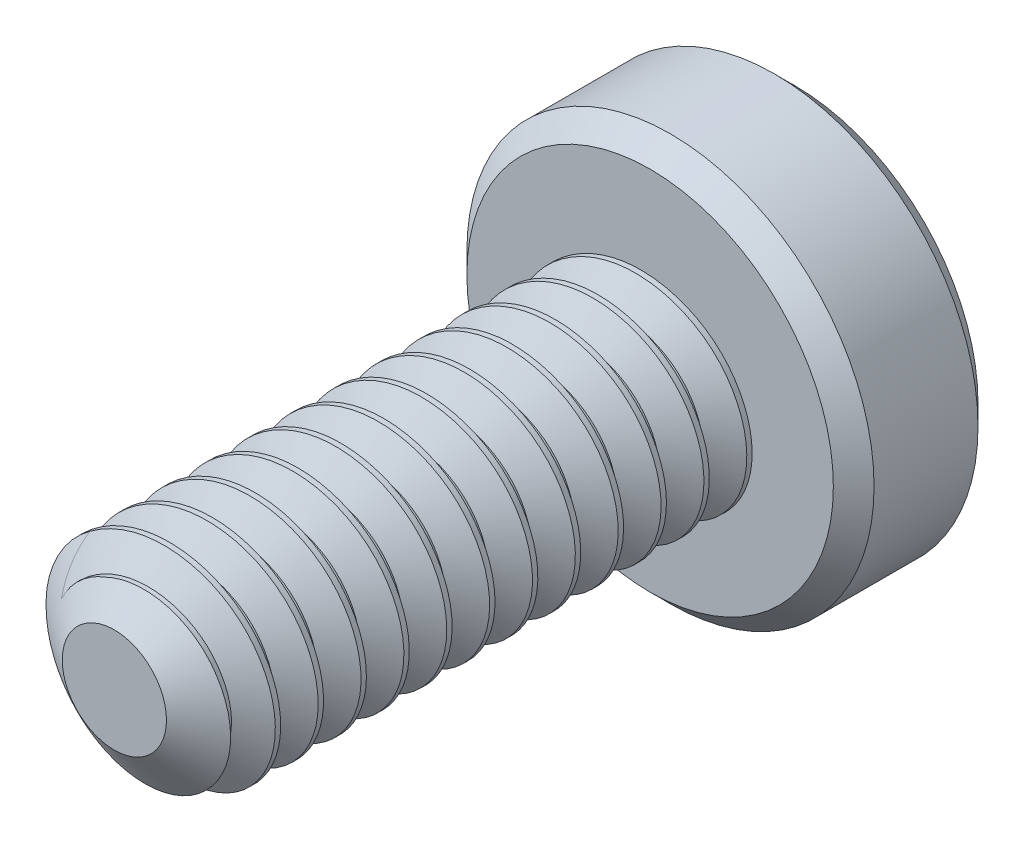
from build123d import *

# Parameters (mm, degrees)
SKETCH1_R          = 1
EXTRUDE1_DEPTH     = 5
CUT_SWEEP1_PITCH   = 0.4
SKETCH6_R          = 1.9
EXTRUDE2_DEPTH     = 1.35
CUT_EXTRUDE1_DEPTH = 0.975
CHAMFER1_SIZE      = 0.19


with BuildPart() as part:
    # Sketch1 → Extrude1 (new body)
    with BuildSketch(Plane.XY):
        Circle(SKETCH1_R)
    extrude(amount=-EXTRUDE1_DEPTH)

    # Cut-Sweep1: the profile of Sketch3 profile screwed along a right-hand helix of 13.5 turns, 6 arcs to a turn; built about Z, then put on its axis
    cut_sweep1_z = Axis((0, 0, 0), (0, 0, 1))
    cut_sweep1_corners = [(1.0003, 0, -0.350173205), (0.740192379, 0, -0.2), (0.740192379, 0, -0.15), (1.0003, 0, 0.000173205)]
    with BuildLine(mode=Mode.PRIVATE) as cut_sweep1_profile:
        Line(cut_sweep1_corners[0], cut_sweep1_corners[1])
        Line(cut_sweep1_corners[1], cut_sweep1_corners[2])
        Line(cut_sweep1_corners[2], cut_sweep1_corners[3])
        Line(cut_sweep1_corners[3], cut_sweep1_corners[0])
    cut_sweep1_cap = Face(cut_sweep1_profile.wire())
    cut_sweep1_turn_angles = [0, 30, 60, 90, 120, 150, 180, 210, 240, 270, 300, 330, 360]
    cut_sweep1_turn_weights = [1, 0.8660254037844387, 1, 0.8660254037844387, 1, 0.8660254037844387, 1, 0.8660254037844387, 1, 0.8660254037844387, 1, 0.8660254037844387, 1]
    cut_sweep1_turn_rails = [Edge.make_bspline([Vector(p[0], p[1], 0).rotate(cut_sweep1_z, cut_sweep1_turn_angles[k]) / cut_sweep1_turn_weights[k] + Vector(0, 0, p[2] + CUT_SWEEP1_PITCH * cut_sweep1_turn_angles[k] / 360) for k in range(13)], [0, 0, 0, 1, 1, 2, 2, 3, 3, 4, 4, 5, 5, 6, 6, 6], 2, cut_sweep1_turn_weights) for p in cut_sweep1_corners]
    cut_sweep1_turn_sides = [Face.make_surface_from_curves(cut_sweep1_turn_rails[p[0]], cut_sweep1_turn_rails[p[1]]) for p in [(0, 1), (1, 2), (2, 3), (3, 0)]]
    cut_sweep1_last_angles = [4680, 4710, 4740, 4770, 4800, 4830, 4860]
    cut_sweep1_last_weights = [1, 0.8660254037844387, 1, 0.8660254037844387, 1, 0.8660254037844347, 1]
    cut_sweep1_last_rails = [Edge.make_bspline([Vector(p[0], p[1], 0).rotate(cut_sweep1_z, cut_sweep1_last_angles[k]) / cut_sweep1_last_weights[k] + Vector(0, 0, p[2] + CUT_SWEEP1_PITCH * cut_sweep1_last_angles[k] / 360) for k in range(7)], [0, 0, 0, 1, 1, 2, 2, 3, 3, 3], 2, cut_sweep1_last_weights) for p in cut_sweep1_corners]
    cut_sweep1_last_sides = [Face.make_surface_from_curves(cut_sweep1_last_rails[p[0]], cut_sweep1_last_rails[p[1]]) for p in [(0, 1), (1, 2), (2, 3), (3, 0)]]
    cut_sweep1 = Plane(origin=(0, 0, 0), x_dir=(0, 1, 0), z_dir=(0, 0, -1)) * Solid(Shell([*[p.moved(Location((0, 0, CUT_SWEEP1_PITCH * i))) for i in range(13) for p in cut_sweep1_turn_sides], *cut_sweep1_last_sides, cut_sweep1_cap, cut_sweep1_cap.rotate(cut_sweep1_z, 4860).moved(Location((0, 0, CUT_SWEEP1_PITCH * 4860 / 360)))]))
    add(cut_sweep1, mode=Mode.SUBTRACT)

    # Sketch4 → Cut-Revolve1 (revolve, cut)
    with BuildSketch(Plane(origin=(0, 0, 0), x_dir=(0, 0, -1), z_dir=(1, 0, 0)), mode=Mode.PRIVATE) as cut_revolve1_sk:
        Polygon((0.35977197, 1), (0, 0.486192379), (0, 1), align=None)
    revolve(cut_revolve1_sk.sketch.rotate(Axis((0, 0, 0), (0, 0, -1)), 278.428757719), axis=Axis((0, 0, 0), (0, 0, -1)), mode=Mode.SUBTRACT)

    # Sketch6 → Extrude2 (add)
    with BuildSketch(Plane(origin=(0, 0, -5), x_dir=(-1, 0, 0), z_dir=(0, 0, -1))):
        with Locations(Location((0, 0, 0), (0, 0, 180))):
            Circle(SKETCH6_R)
    extrude(amount=EXTRUDE2_DEPTH)

    # Sketch7 → Cut-Extrude1 (cut)
    with BuildSketch(Plane(origin=(0, 0, -6.35), x_dir=(-1, 0, 0), z_dir=(0, 0, -1))):
        Polygon((0, 0.75055535), (-0.65, 0.375277675), (-0.65, -0.375277675), (0, -0.75055535), (0.65, -0.375277675), (0.65, 0.375277675), align=None)
    extrude(amount=-CUT_EXTRUDE1_DEPTH, mode=Mode.SUBTRACT)

    # Cut-Extrude2 cone 1 section (through the dimple's axis) → Cut-Extrude2 (revolve, cut)
    with BuildSketch(Plane(origin=(0, 0, -6.35), x_dir=(0, 1, 0), z_dir=(1, 0, 0))):
        Polygon((0, 0), (0.75055535, 0), (0, 0.75055535), align=None)
    revolve(axis=Axis((0, 0, -6.35), (0, 0, 1)), mode=Mode.SUBTRACT)

    # Chamfer1
    chamfer1_edges = [part.edges().sort_by_distance(p)[0] for p in [
        (-1.9, 0, -5),
        (-1.9, 0, -6.35),
    ]]
    chamfer(chamfer1_edges, length=CHAMFER1_SIZE)


solid = part.part
